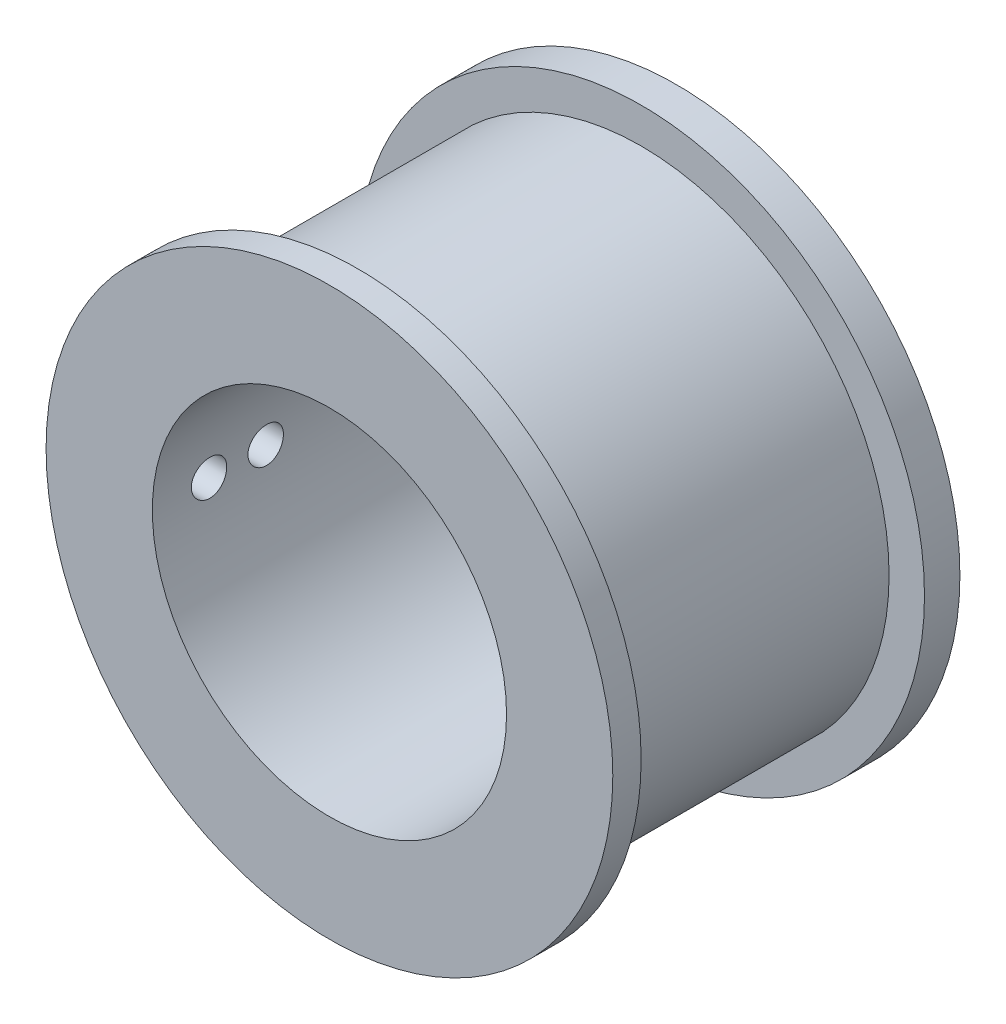
from build123d import *

# Parameters (mm, degrees)
SKETCH1_R           = 25.4
SKETCH1_R_2         = 1.7
BOSS_EXTRUDE1_DEPTH = 3.175
SKETCH4_R           = 22.225
SKETCH4_R_2         = 15.875
BOSS_EXTRUDE2_DEPTH = 25.4
SKETCH5_R           = 25.4
SKETCH5_R_2         = 15.875
BOSS_EXTRUDE3_DEPTH = 2.54
SKETCH6_R           = 1.5875
CUT_EXTRUDE1_DEPTH  = 48.523291395


with BuildPart() as part:
    # Sketch1 → Boss-Extrude1 (new body)
    with BuildSketch(Plane.XY):
        Circle(SKETCH1_R)
        with Locations((0, -8.001)):
            Circle(SKETCH1_R_2, mode=Mode.SUBTRACT)
        with Locations((0, 8.001)):
            Circle(SKETCH1_R_2, mode=Mode.SUBTRACT)
        with Locations((-6.929069256, 4.0005)):
            Circle(SKETCH1_R_2, mode=Mode.SUBTRACT)
        with Locations((-6.929069256, -4.0005)):
            Circle(SKETCH1_R_2, mode=Mode.SUBTRACT)
        with Locations((6.929069256, -4.0005)):
            Circle(SKETCH1_R_2, mode=Mode.SUBTRACT)
        with Locations((6.929069256, 4.0005)):
            Circle(SKETCH1_R_2, mode=Mode.SUBTRACT)
    extrude(amount=BOSS_EXTRUDE1_DEPTH)

    # Sketch4 → Boss-Extrude2 (add)
    with BuildSketch(Plane.XY.offset(3.175)):
        Circle(SKETCH4_R)
        Circle(SKETCH4_R_2, mode=Mode.SUBTRACT)
    extrude(amount=BOSS_EXTRUDE2_DEPTH)

    # Sketch5 → Boss-Extrude3 (add)
    with BuildSketch(Plane.XY.offset(28.575)):
        Circle(SKETCH5_R)
        Circle(SKETCH5_R_2, mode=Mode.SUBTRACT)
    extrude(amount=BOSS_EXTRUDE3_DEPTH)

    # Sketch6 → Cut-Extrude1 (cut, through all)
    with BuildSketch(Plane(origin=(0, 0, 0), x_dir=(0, 0, -1), z_dir=(1, 0, 0))):
        with Locations((-26.035, 0)):
            Circle(SKETCH6_R)
        with Locations((-20.955, 0)):
            Circle(SKETCH6_R)
    extrude(amount=-CUT_EXTRUDE1_DEPTH, mode=Mode.SUBTRACT)


solid = part.part
